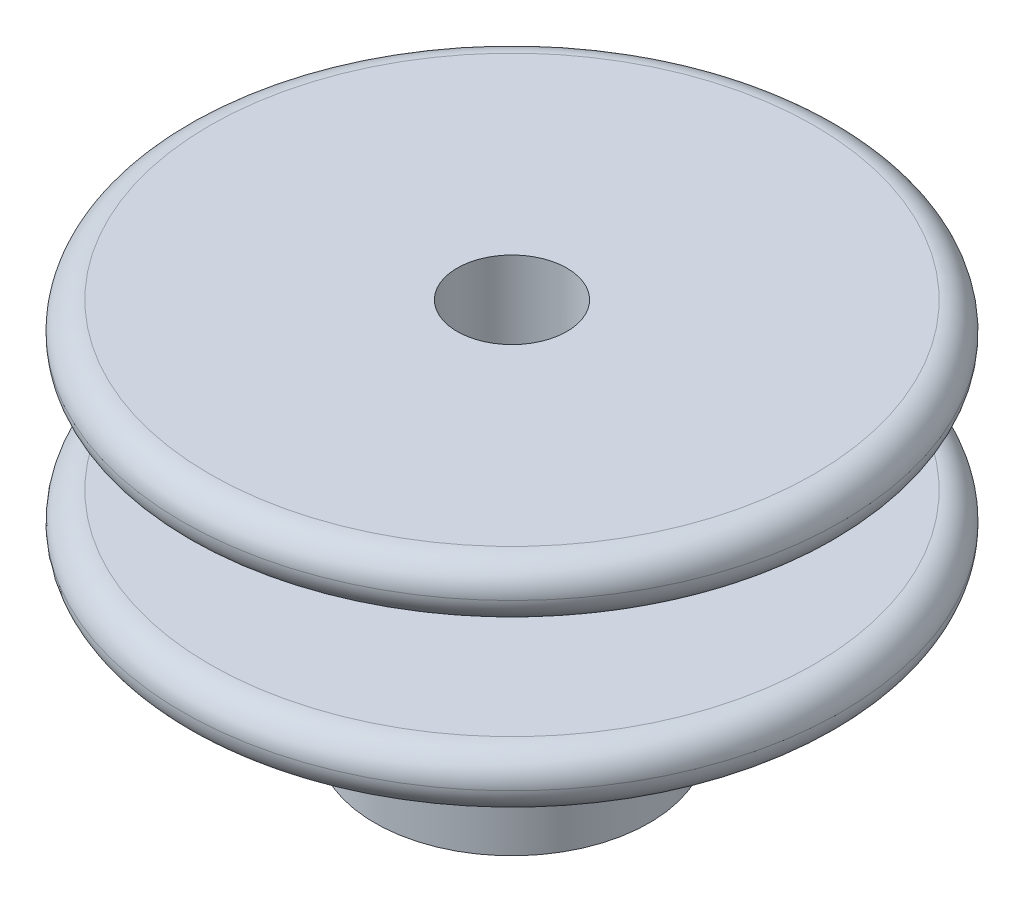
from build123d import *

# Parameters (mm, degrees)
SKETCH_1_R          = 5
EXTRUDE_1_DEPTH     = 4
SKETCH_2_R          = 12
EXTRUDE_2_DEPTH     = 2
EXTRUDE_START       = 2
SKETCH_3_R          = 12
EXTRUDE_3_DEPTH     = 2
EXTRUDE_START_2     = 6
SKETCH_4_R          = 5
EXTRUDE_4_DEPTH     = 6
SKETCH_5_R          = 2
CUT_EXTRUDE_1_DEPTH = 23
FILLET_2_R          = 1
SKETCH_6_R          = 1
CUT_EXTRUDE_2_DEPTH = 19.761663039


with BuildPart() as part:
    # 草图1 → 凸台-拉伸1 (new body)
    with BuildSketch(Plane(origin=(0, 0, 0), x_dir=(1, 0, 0), z_dir=(0, 1, 0))):
        with Locations(Location((0, 0, 0), (0, 0, 270))):
            Circle(SKETCH_1_R)
    extrude(amount=EXTRUDE_1_DEPTH)

    # 草图2 → 凸台-拉伸2 (add)
    with BuildSketch(Plane(origin=(0, 4, 0), x_dir=(1, 0, 0), z_dir=(0, 1, 0))):
        with Locations(Location((0, 0, 0), (0, 0, 270))):
            Circle(SKETCH_2_R)
    extrude(amount=EXTRUDE_2_DEPTH)

    # 草图3 → 凸台-拉伸3 (add)
    with BuildSketch(Plane.XZ.offset(EXTRUDE_START)):
        with Locations(Location((0, 0, 0), (0, 0, 90))):
            Circle(SKETCH_3_R)
    extrude(amount=-EXTRUDE_3_DEPTH)

    # 草图4 → 凸台-拉伸4 (add)
    with BuildSketch(Plane(origin=(0, -2, 0), x_dir=(-1, 0, 0), z_dir=(0, -1, 0)).offset(EXTRUDE_START_2)):
        with Locations(Location((0, 0, 0), (0, 0, 270))):
            Circle(SKETCH_4_R)
    extrude(amount=-EXTRUDE_4_DEPTH)

    # 草图5 → 切除-拉伸1 (cut, through all)
    with BuildSketch(Plane.XZ.offset(8)):
        with Locations(Location((0, 0, 0), (0, 0, 270))):
            Circle(SKETCH_5_R)
    extrude(amount=-CUT_EXTRUDE_1_DEPTH, mode=Mode.SUBTRACT)

    # 圆角2
    fillet_2_edges = [part.edges().sort_by_distance(p)[0] for p in [
        (0, -2, -12),
        (0, 4, -12),
        (0, 6, -12),
        (0, 0, -12),
    ]]
    fillet(fillet_2_edges, radius=FILLET_2_R - 0.0001)  # a hair under: the kernel refuses the full size

    # 草图6 → 切除-拉伸2 (cut, through all)
    with BuildSketch(Plane.XY):
        with Locations(Location((0, -4, 0), (0, 0, 90))):
            Circle(SKETCH_6_R)
    extrude(amount=-CUT_EXTRUDE_2_DEPTH, mode=Mode.SUBTRACT)


solid = part.part
